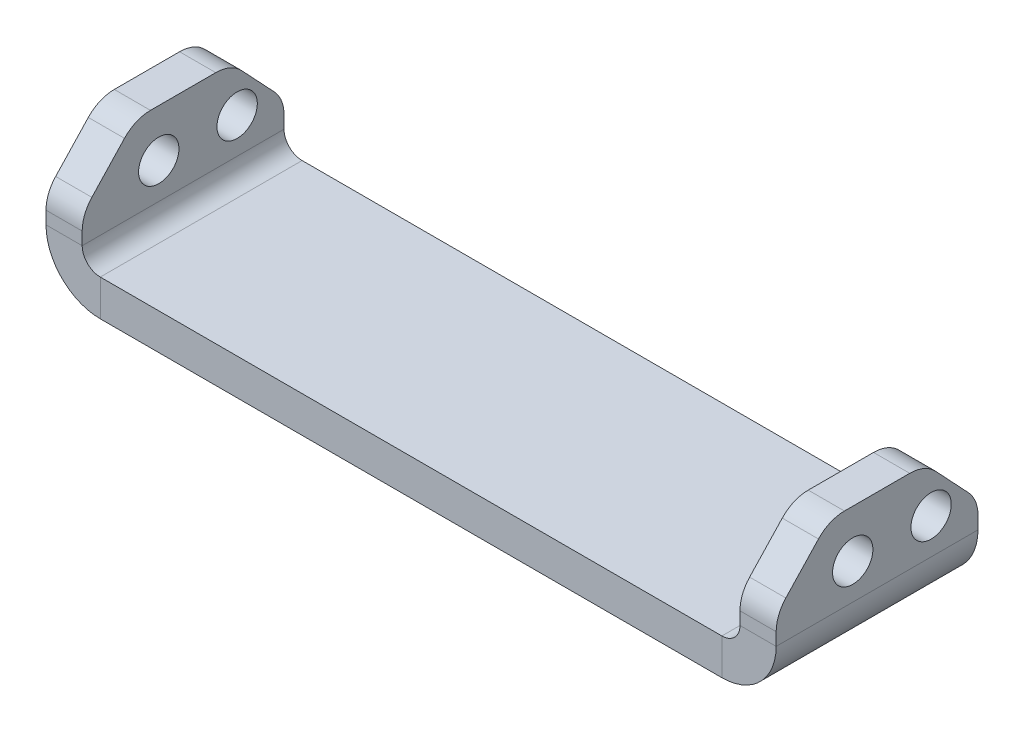
from build123d import *

# Parameters (mm, degrees)
SKETCH20_W                     = 61.5
SKETCH20_H                     = 17
BASE_FLANGE1_DEPTH             = 3.048
EDGE_FLANGE1_STRIP_W           = 15.24
EDGE_FLANGE1_STRIP_H           = 3.048
EDGE_FLANGE1_STRIP_CUT_DEPTH   = 17
EDGE_FLANGE1_STRIP_2_W         = 15.24
EDGE_FLANGE1_STRIP_2_H         = 3.048
EDGE_FLANGE1_STRIP_CUT_2_DEPTH = 17
EDGE_FLANGE1_DEPTH             = 17
EDGE_FLANGE1_BEND_DEPTH        = 17
CUT_EXTRUDE3_DEPTH             = 66.770177923
CUT_EXTRUDE3_DEPTH_BACK        = 66.770177923
M3_CLEARANCE_HOLE1_D           = 3.4


# Sheet-metal steps are written as plain solids
with BuildPart() as part:
    # Sketch20 → Base-Flange1 (new body)
    with BuildSketch(Plane(origin=(0, 0, 0), x_dir=(1, 0, 0), z_dir=(0, 1, 0))):
        with Locations((30.75, 8.5)):
            Rectangle(SKETCH20_W, SKETCH20_H)
    extrude(amount=-BASE_FLANGE1_DEPTH)

    # Edge-Flange1 strip (across the edge) → Edge-Flange1 strip cut (cut)
    with BuildSketch(Plane.XY.offset(-17)):
        with Locations((-3.048, -1.524)):
            Rectangle(EDGE_FLANGE1_STRIP_W, EDGE_FLANGE1_STRIP_H)
    extrude(amount=EDGE_FLANGE1_STRIP_CUT_DEPTH, mode=Mode.SUBTRACT)

    # Edge-Flange1 strip 2 (across the edge) → Edge-Flange1 strip cut 2 (cut)
    with BuildSketch(Plane(origin=(61.5, 0, 0), x_dir=(-1, 0, 0), z_dir=(0, 0, -1))):
        with Locations((-3.048, -1.524)):
            Rectangle(EDGE_FLANGE1_STRIP_2_W, EDGE_FLANGE1_STRIP_2_H)
    extrude(amount=EDGE_FLANGE1_STRIP_CUT_2_DEPTH, mode=Mode.SUBTRACT)

    # Edge-Flange1 section (across the edge) → Edge-Flange1 (add)
    with BuildSketch(Plane.XY.offset(-17)):
        with BuildLine():
            Line((0, 1.524), (0, 15.952))
            Line((0, 15.952), (3.048, 15.952))
            Line((3.048, 15.952), (3.048, 1.524))
            ThreePointArc((3.048, 1.524), (3.494369265, 0.446369265), (4.572, 0))
            Line((4.572, 0), (4.572, -3.048))
            ThreePointArc((4.572, -3.048), (1.339107796, -1.708892204), (0, 1.524))
        make_face()
    extrude(amount=EDGE_FLANGE1_DEPTH)

    # Edge-Flange1 section 2 (across the edge) → Edge-Flange1 bend (add)
    with BuildSketch(Plane(origin=(61.5, 0, 0), x_dir=(-1, 0, 0), z_dir=(0, 0, -1))):
        with BuildLine():
            Line((0, 1.524), (0, 15.952))
            Line((0, 15.952), (3.048, 15.952))
            Line((3.048, 15.952), (3.048, 1.524))
            ThreePointArc((3.048, 1.524), (3.494369265, 0.446369265), (4.572, 0))
            Line((4.572, 0), (4.572, -3.048))
            ThreePointArc((4.572, -3.048), (1.339107796, -1.708892204), (0, 1.524))
        make_face()
    extrude(amount=EDGE_FLANGE1_BEND_DEPTH)

    # Sketch29 → Cut-Extrude3 (cut, two sides: drawn at the far end of the back side and taken through both)
    with BuildSketch(Plane(origin=(0, 0, 0), x_dir=(0, 0, -1), z_dir=(1, 0, 0)).offset(-CUT_EXTRUDE3_DEPTH_BACK)):
        with BuildLine():
            Line((0, 1.524), (0, 2.594))
            ThreePointArc((0, 2.594), (0.210525003, 3.698005998), (0.812552829, 4.647064751))
            Line((0.812552829, 4.647064751), (3.562552829, 7.577064751))
            ThreePointArc((3.562552829, 7.577064751), (4.558193441, 8.277106814), (5.75, 8.524))
            Line((5.75, 8.524), (11.25, 8.524))
            ThreePointArc((11.25, 8.524), (12.441806559, 8.277106814), (13.437447171, 7.577064751))
            Line((13.437447171, 7.577064751), (16.187447171, 4.647064751))
            ThreePointArc((16.187447171, 4.647064751), (16.789474997, 3.698005998), (17, 2.594))
            Line((17, 2.594), (17, 1.524))
            Line((17, 1.524), (21.797856885, 1.524))
            Line((21.797856885, 1.524), (21.797856885, 17.003274098))
            Line((21.797856885, 17.003274098), (-4.797856885, 17.003274098))
            Line((-4.797856885, 17.003274098), (-4.797856885, 1.524))
            Line((-4.797856885, 1.524), (0, 1.524))
        make_face()
    extrude(amount=CUT_EXTRUDE3_DEPTH + CUT_EXTRUDE3_DEPTH_BACK, mode=Mode.SUBTRACT)

    # M3 Clearance Hole1 (through all)
    with Locations(Plane(origin=(0, 4.524, -13.05), x_dir=(0, -1, 0), z_dir=(-1, 0, 0))):
        with Locations((0, 0), (0, 6.6)):
            Hole(M3_CLEARANCE_HOLE1_D / 2)


solid = part.part
